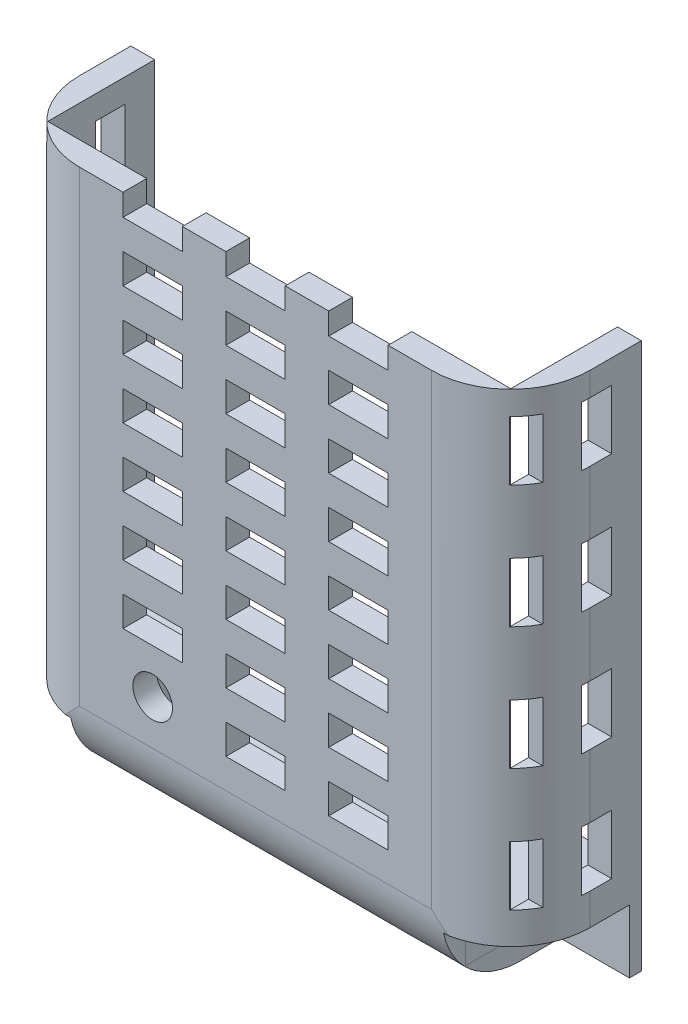
from build123d import *

# Parameters (mm, degrees)
ESBO_O1_W                = 129
ESBO_O1_H                = 276
ESBO_O1_R                = 1.6
RESSALTO_EXTRUS_O1_DEPTH = 3
ESBO_O4_W                = 70
ESBO_O4_H                = 6
ESBO_O4_W_2              = 6
ESBO_O4_H_2              = 100
RESSALTO_EXTRUS_O2_DEPTH = 24
RESSALTO_EXTRUS_O3_DEPTH = 6
RESSALTO_EXTRUS_O5_DEPTH = 27
RESSALTO_EXTRUS_O6_DEPTH = 94
FILETE1_R                = 20
ESBO_O9_R                = 5
ESBO_O9_W                = 15
ESBO_O9_H                = 7.5
CORTE_EXTRUS_O1_DEPTH    = 6
ESBO_O10_W               = 15
ESBO_O10_H               = 7.5
CORTE_EXTRUS_O2_DEPTH    = 6
ESBO_O11_W               = 15
ESBO_O11_H               = 7.5
CORTE_EXTRUS_O3_DEPTH    = 6
ESBO_O12_W               = 7.5
ESBO_O12_H               = 15
CORTE_EXTRUS_O4_DEPTH    = 6
CORTE_EXTRUS_O5_START    = -33
ESBO_O13_W               = 129
ESBO_O13_H               = 138
CORTE_EXTRUS_O5_DEPTH    = 33


with BuildPart() as part:
    # Esboço1 → Ressalto-extrusão1 (new body)
    with BuildSketch(Plane.XY):
        Rectangle(ESBO_O1_W, ESBO_O1_H)
        with Locations((-53.125, -128)):
            Circle(ESBO_O1_R, mode=Mode.SUBTRACT)
        with Locations((-41, 130.5)):
            Circle(ESBO_O1_R, mode=Mode.SUBTRACT)
        with Locations(Location((41, 130.5, 0), (0, 0, 180))):
            Circle(ESBO_O1_R, mode=Mode.SUBTRACT)
        with Locations(Location((53.125, -128, 0), (0, 0, 180))):
            Circle(ESBO_O1_R, mode=Mode.SUBTRACT)
        Polygon((-47.125, -132), (-47.125, -122), (-58.5, -122), (-58.5, 132), (-47, 132), (-47, 124.5), (-35, 124.5), (-35, 132), (35, 132), (35, 124.5), (47, 124.5), (47, 132), (58.5, 132), (58.5, -122), (47.125, -122), (47.125, -132), align=None, mode=Mode.SUBTRACT)
    extrude(amount=RESSALTO_EXTRUS_O1_DEPTH)

    # Esboço4 → Ressalto-extrusão2 (add)
    with BuildSketch(Plane.XY.offset(3)):
        Polygon((-64.5, 138), (-64.5, 72), (-58.5, 72), (-58.5, 132), (-47, 132), (-47, 138), align=None)
        with Locations((0, 135)):
            Rectangle(ESBO_O4_W, ESBO_O4_H)
        Polygon((47, 132), (47, 138), (64.5, 138), (64.5, 72), (58.5, 72), (58.5, 132), align=None)
        Polygon((-47.125, -132), (-47.125, -138), (47, -138), (47.125, -132), align=None)
        with Locations((-61.5, -72)):
            Rectangle(ESBO_O4_W_2, ESBO_O4_H_2)
        with Locations((61.5, -72)):
            Rectangle(ESBO_O4_W_2, ESBO_O4_H_2)
    extrude(amount=RESSALTO_EXTRUS_O2_DEPTH)

    # Esboço5 → Ressalto-extrusão3 (add)
    with BuildSketch(Plane.XY.offset(27)):
        Polygon((-35, 132), (-35, 138), (35, 138), (35, 132), (35, 124.5), (47, 124.5), (47, 132), (47, 138), (64.5, 138), (64.5, 72), (58.5, 72), (-64.5, 72), (-64.5, 138), (-47, 138), (-47, 124.5), (-35, 124.5), align=None)
        Polygon((-47.125, -138), (47, -138), (47.125, -122), (64.5, -122), (64.5, -22), (-64.5, -22), (-64.5, -122), (-47.125, -122), align=None)
    extrude(amount=RESSALTO_EXTRUS_O3_DEPTH)

    # Esboço7 → Ressalto-extrusão5 (add)
    with BuildSketch(Plane(origin=(0, 0, 27), x_dir=(-1, 0, 0), z_dir=(0, 0, -1))):
        Polygon((-47, 132), (-53, 132), (-53, 118.5), (-29, 118.5), (-29, 132), (-35, 132), (-35, 124.5), (-47, 124.5), align=None)
        Polygon((47.125, -132), (47.125, -122), (58.5, -122), (58.5, -116), (41.125, -116), (41.125, -132), align=None)
        Polygon((47, 124.5), (47, 132), (53, 132), (53, 118.5), (29, 118.5), (29, 132), (35, 132), (35, 124.5), align=None)
        Polygon((-41.125, -132), (-47.125, -132), (-47.125, -122), (-58.5, -122), (-58.5, -116), (-41.125, -116), align=None)
    extrude(amount=RESSALTO_EXTRUS_O5_DEPTH)

    # Esboço8 → Ressalto-extrusão6 (add)
    with BuildSketch(Plane(origin=(0, -22, 0), x_dir=(1, 0, 0), z_dir=(0, 1, 0))):
        Polygon((-58.5, -3), (-64.5, -3), (-64.5, -33), (64.5, -33), (64.5, -3), (58.5, -3), (58.5, -27), (-58.5, -27), align=None)
    extrude(amount=RESSALTO_EXTRUS_O6_DEPTH)

    # Filete1
    # the kernel refuses this fillet: 20 mm, written as the material it takes off along each edge
    with BuildSketch(Plane(origin=(-85, 138, 33), x_dir=(0, 0, -1), z_dir=(1, 0, 0))) as filete1_piece_1:
        with BuildLine():
            CenterArc((FILETE1_R, -FILETE1_R), FILETE1_R, 90, 90)
            Line((0, -FILETE1_R), (0, 0))
            Line((0, 0), (FILETE1_R, 0))
        make_face()
    extrude(amount=170, mode=Mode.SUBTRACT)
    with BuildSketch(Plane(origin=(-97.125, -138, 33), x_dir=(0, 0, -1), z_dir=(1, 0, 0))) as filete1_piece_2:
        with BuildLine():
            CenterArc((FILETE1_R, FILETE1_R), FILETE1_R, 180, 90)
            Line((0, FILETE1_R), (0, 0))
            Line((0, 0), (FILETE1_R, 0))
        make_face()
    extrude(amount=194.125, mode=Mode.SUBTRACT)
    with BuildSketch(Plane(origin=(64.5, -172, 33), x_dir=(0, 0, -1), z_dir=(0, 1, 0)), Plane(origin=(-64.5, -172, 33), x_dir=(1, 0, 0), z_dir=(0, 1, 0))) as filete1_piece_3:
        with BuildLine():
            CenterArc((FILETE1_R, FILETE1_R), FILETE1_R, 180, 90)
            Line((0, FILETE1_R), (0, 0))
            Line((0, 0), (FILETE1_R, 0))
        make_face()
    extrude(amount=360, mode=Mode.SUBTRACT)

    # Esboço9 → Corte-extrusão1 (cut)
    with BuildSketch(Plane.XY.offset(33)):
        with Locations((-26, -106.75)):
            Circle(ESBO_O9_R)
        with Locations((0, -106.75)):
            Rectangle(ESBO_O9_W, ESBO_O9_H)
        with Locations((26, -106.75)):
            Rectangle(ESBO_O9_W, ESBO_O9_H)
        with Locations((-26, -91.75)):
            Rectangle(ESBO_O9_W, ESBO_O9_H)
        with Locations((0, -91.75)):
            Rectangle(ESBO_O9_W, ESBO_O9_H)
        with Locations((26, -91.75)):
            Rectangle(ESBO_O9_W, ESBO_O9_H)
        with Locations((-26, -76.75)):
            Rectangle(ESBO_O9_W, ESBO_O9_H)
        with Locations((0, -76.75)):
            Rectangle(ESBO_O9_W, ESBO_O9_H)
        with Locations((26, -76.75)):
            Rectangle(ESBO_O9_W, ESBO_O9_H)
        with Locations((-26, -61.75)):
            Rectangle(ESBO_O9_W, ESBO_O9_H)
        with Locations((0, -61.75)):
            Rectangle(ESBO_O9_W, ESBO_O9_H)
        with Locations((26, -61.75)):
            Rectangle(ESBO_O9_W, ESBO_O9_H)
        with Locations((-26, -46.75)):
            Rectangle(ESBO_O9_W, ESBO_O9_H)
        with Locations((0, -46.75)):
            Rectangle(ESBO_O9_W, ESBO_O9_H)
        with Locations((26, -46.75)):
            Rectangle(ESBO_O9_W, ESBO_O9_H)
        with Locations((-26, -31.75)):
            Rectangle(ESBO_O9_W, ESBO_O9_H)
        with Locations((0, -31.75)):
            Rectangle(ESBO_O9_W, ESBO_O9_H)
        with Locations((26, -31.75)):
            Rectangle(ESBO_O9_W, ESBO_O9_H)
        with Locations((-26, -16.75)):
            Rectangle(ESBO_O9_W, ESBO_O9_H)
        with Locations((0, -16.75)):
            Rectangle(ESBO_O9_W, ESBO_O9_H)
        with Locations((26, -16.75)):
            Rectangle(ESBO_O9_W, ESBO_O9_H)
        with Locations((-26, -1.75)):
            Rectangle(ESBO_O9_W, ESBO_O9_H)
        with Locations((0, -1.75)):
            Rectangle(ESBO_O9_W, ESBO_O9_H)
        with Locations((26, -1.75)):
            Rectangle(ESBO_O9_W, ESBO_O9_H)
        with Locations((-26, 13.25)):
            Rectangle(ESBO_O9_W, ESBO_O9_H)
        with Locations((0, 13.25)):
            Rectangle(ESBO_O9_W, ESBO_O9_H)
        with Locations((26, 13.25)):
            Rectangle(ESBO_O9_W, ESBO_O9_H)
        with Locations((-26, 28.25)):
            Rectangle(ESBO_O9_W, ESBO_O9_H)
        with Locations((0, 28.25)):
            Rectangle(ESBO_O9_W, ESBO_O9_H)
        with Locations((26, 28.25)):
            Rectangle(ESBO_O9_W, ESBO_O9_H)
        with Locations((-26, 43.25)):
            Rectangle(ESBO_O9_W, ESBO_O9_H)
        with Locations((0, 43.25)):
            Rectangle(ESBO_O9_W, ESBO_O9_H)
        with Locations((26, 43.25)):
            Rectangle(ESBO_O9_W, ESBO_O9_H)
        with Locations((-26, 58.25)):
            Rectangle(ESBO_O9_W, ESBO_O9_H)
        with Locations((0, 58.25)):
            Rectangle(ESBO_O9_W, ESBO_O9_H)
        with Locations((26, 58.25)):
            Rectangle(ESBO_O9_W, ESBO_O9_H)
        with Locations((-26, 73.25)):
            Rectangle(ESBO_O9_W, ESBO_O9_H)
        with Locations((0, 73.25)):
            Rectangle(ESBO_O9_W, ESBO_O9_H)
        with Locations((26, 73.25)):
            Rectangle(ESBO_O9_W, ESBO_O9_H)
        with Locations((-26, 88.25)):
            Rectangle(ESBO_O9_W, ESBO_O9_H)
        with Locations((0, 88.25)):
            Rectangle(ESBO_O9_W, ESBO_O9_H)
        with Locations((26, 88.25)):
            Rectangle(ESBO_O9_W, ESBO_O9_H)
        with Locations((-26, 103.25)):
            Rectangle(ESBO_O9_W, ESBO_O9_H)
        with Locations((0, 103.25)):
            Rectangle(ESBO_O9_W, ESBO_O9_H)
        with Locations((26, 103.25)):
            Rectangle(ESBO_O9_W, ESBO_O9_H)
    extrude(amount=-CORTE_EXTRUS_O1_DEPTH, mode=Mode.SUBTRACT)

    # Esboço10 → Corte-extrusão2 (cut)
    with BuildSketch(Plane.XZ.offset(138)):
        with Locations((-32.125, 24.25)):
            Rectangle(ESBO_O10_W, ESBO_O10_H)
        with Locations((-2.125, 24.25)):
            Rectangle(ESBO_O10_W, ESBO_O10_H)
        with Locations((27.875, 24.25)):
            Rectangle(ESBO_O10_W, ESBO_O10_H)
        with Locations((-32.125, 11.75)):
            Rectangle(ESBO_O10_W, ESBO_O10_H)
        with Locations((-2.125, 11.75)):
            Rectangle(ESBO_O10_W, ESBO_O10_H)
        with Locations((27.875, 11.75)):
            Rectangle(ESBO_O10_W, ESBO_O10_H)
    extrude(amount=-CORTE_EXTRUS_O2_DEPTH, mode=Mode.SUBTRACT)

    # Esboço11 → Corte-extrusão3 (cut)
    with BuildSketch(Plane(origin=(0, 138, 0), x_dir=(1, 0, 0), z_dir=(0, 1, 0))):
        with Locations((-21.365084691, -21.75)):
            Rectangle(ESBO_O11_W, ESBO_O11_H)
        with Locations((-1.365084691, -21.75)):
            Rectangle(ESBO_O11_W, ESBO_O11_H)
        with Locations((18.634915309, -21.75)):
            Rectangle(ESBO_O11_W, ESBO_O11_H)
        with Locations((-1.365084691, -6.75)):
            Rectangle(ESBO_O11_W, ESBO_O11_H)
        with Locations((18.634915309, -6.75)):
            Rectangle(ESBO_O11_W, ESBO_O11_H)
        with Locations((-21.365084691, -6.75)):
            Rectangle(ESBO_O11_W, ESBO_O11_H)
    extrude(amount=-CORTE_EXTRUS_O3_DEPTH, mode=Mode.SUBTRACT)

    # Esboço12 → Corte-extrusão4 (cut)
    with BuildSketch(Plane.ZY.offset(64.5)):
        with Locations((11.25, 110.5)):
            Rectangle(ESBO_O12_W, ESBO_O12_H)
        with Locations((26.25, 110.5)):
            Rectangle(ESBO_O12_W, ESBO_O12_H)
        with Locations((26.25, 79.5)):
            Rectangle(ESBO_O12_W, ESBO_O12_H)
        with Locations((26.25, 48.5)):
            Rectangle(ESBO_O12_W, ESBO_O12_H)
        with Locations((26.25, 17.5)):
            Rectangle(ESBO_O12_W, ESBO_O12_H)
        with Locations((26.25, -13.5)):
            Rectangle(ESBO_O12_W, ESBO_O12_H)
        with Locations((26.25, -44.5)):
            Rectangle(ESBO_O12_W, ESBO_O12_H)
        with Locations((26.25, -75.5)):
            Rectangle(ESBO_O12_W, ESBO_O12_H)
        with Locations((26.25, -106.5)):
            Rectangle(ESBO_O12_W, ESBO_O12_H)
        with Locations((11.25, 79.5)):
            Rectangle(ESBO_O12_W, ESBO_O12_H)
        with Locations((11.25, 48.5)):
            Rectangle(ESBO_O12_W, ESBO_O12_H)
        with Locations((11.25, 17.5)):
            Rectangle(ESBO_O12_W, ESBO_O12_H)
        with Locations((11.25, -13.5)):
            Rectangle(ESBO_O12_W, ESBO_O12_H)
        with Locations((11.25, -44.5)):
            Rectangle(ESBO_O12_W, ESBO_O12_H)
        with Locations((11.25, -75.5)):
            Rectangle(ESBO_O12_W, ESBO_O12_H)
        with Locations((11.25, -106.5)):
            Rectangle(ESBO_O12_W, ESBO_O12_H)
    corte_extrus_o4 = extrude(amount=-CORTE_EXTRUS_O4_DEPTH, mode=Mode.SUBTRACT)

    # Espelhar2: Corte-extrusão4 across plane
    add(corte_extrus_o4.mirror(Plane(origin=(0, 0, 0), x_dir=(0, 0, 1), z_dir=(1, 0, 0))), mode=Mode.SUBTRACT)

    # Esboço13 → Corte-extrusão5 (cut)
    with BuildSketch(Plane.XY.offset(33).offset(CORTE_EXTRUS_O5_START)):
        with Locations((0, 69)):
            Rectangle(ESBO_O13_W, ESBO_O13_H)
    extrude(amount=CORTE_EXTRUS_O5_DEPTH, mode=Mode.SUBTRACT)


solid = part.part
